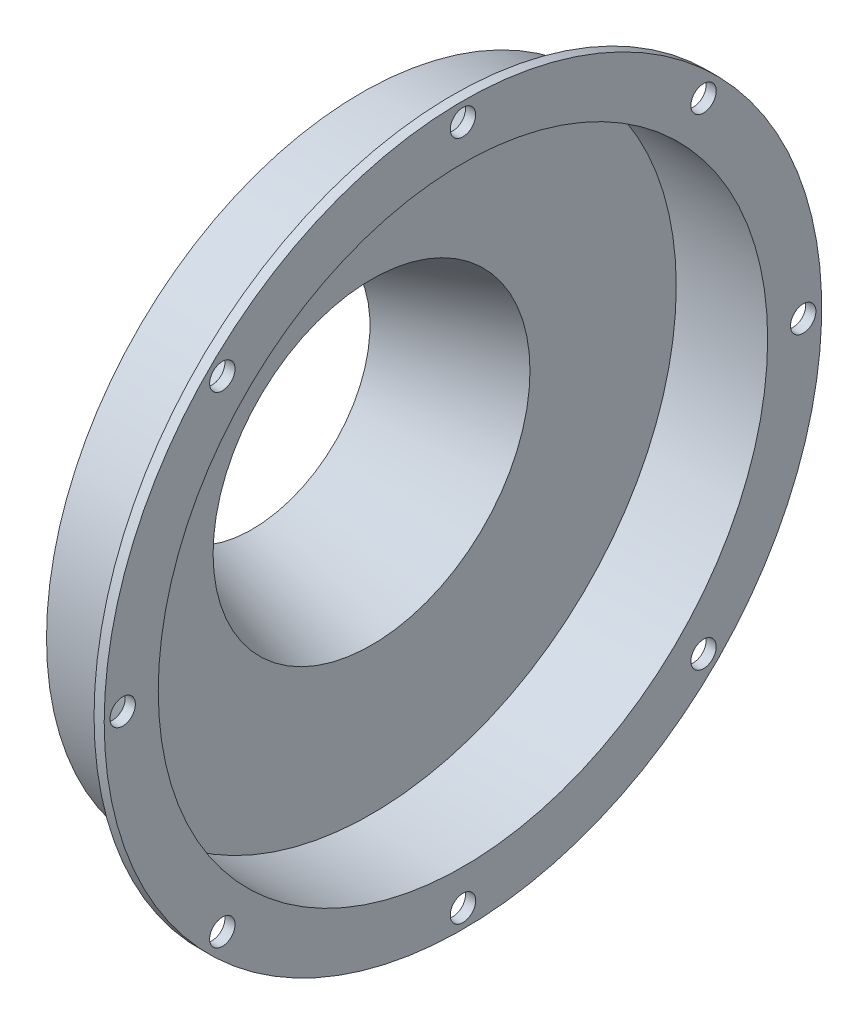
from build123d import *

# Parameters (mm, degrees)
SKETCH2_R          = 3.175
CUT_EXTRUDE1_DEPTH = 2.54
CIRPATTERN1_COUNT  = 8


with BuildPart() as part:
    # Sketch1 → Revolve1 (revolve)
    with BuildSketch(Plane.XY):
        Polygon((0, 29.464), (29.845, 39.624), (29.845, 76.2), (52.705, 76.2), (52.705, 89.7128), (50.165, 89.7128), (50.165, 78.74), (27.305, 78.74), (27.305, 41.442465245), (-0.818550046, 31.868490761), align=None)
    revolve(axis=Axis((0, 0, 0), (1, 0, 0)))

    # Sketch2 → Cut-Extrude1 (cut)
    with BuildSketch(Plane.ZY.offset(-50.165)):
        with Locations((0, 85.09)):
            Circle(SKETCH2_R)
    cut_extrude1 = extrude(amount=-CUT_EXTRUDE1_DEPTH, mode=Mode.SUBTRACT)

    # CirPattern1: Cut-Extrude1 ×8 about axis
    cirpattern1_axis = Axis((50.165, 0, 0), (-1, 0, 0))
    for i in range(1, CIRPATTERN1_COUNT):
        add(cut_extrude1.rotate(cirpattern1_axis, i * 360 / CIRPATTERN1_COUNT), mode=Mode.SUBTRACT)


solid = part.part
